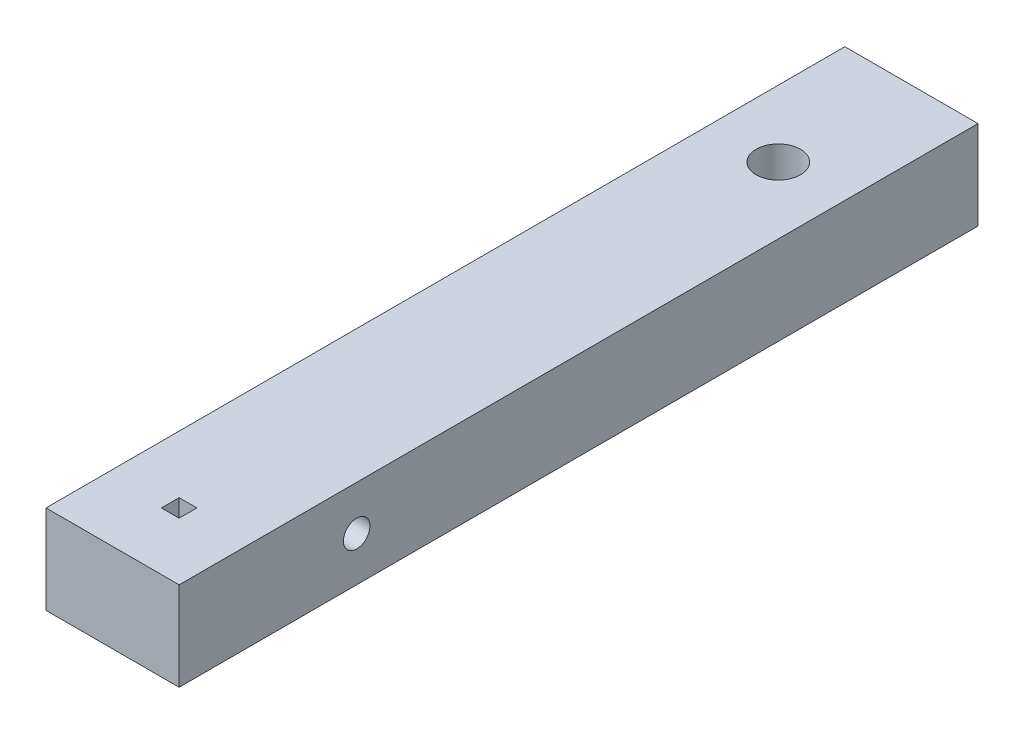
from build123d import *

# Parameters (mm, degrees)
SKETCH1_W           = 15
SKETCH1_H           = 90
BOSS_EXTRUDE1_DEPTH = 10
SKETCH2_R           = 1.5
CUT_EXTRUDE1_DEPTH  = 49.476798574
SKETCH5_W           = 2
SKETCH5_H           = 2
CUT_EXTRUDE4_DEPTH  = 47.703854231
SKETCH6_R           = 2.5
CUT_EXTRUDE5_DEPTH  = 47.703854231
SKETCH7_W           = 2
SKETCH7_H           = 2
CUT_EXTRUDE6_DEPTH  = 15


with BuildPart() as part:
    # Sketch1 → Boss-Extrude1 (new body)
    with BuildSketch(Plane(origin=(0, 0, 0), x_dir=(1, 0, 0), z_dir=(0, 1, 0))):
        Rectangle(SKETCH1_W, SKETCH1_H)
    extrude(amount=BOSS_EXTRUDE1_DEPTH)

    # Sketch2 → Cut-Extrude1 (cut, through all)
    with BuildSketch(Plane(origin=(7.5, 0, 0), x_dir=(0, 0, -1), z_dir=(1, 0, 0))):
        with Locations((-25, 5)):
            Circle(SKETCH2_R)
    extrude(amount=-CUT_EXTRUDE1_DEPTH, mode=Mode.SUBTRACT)

    # Sketch5 → Cut-Extrude4 (cut, through all)
    with BuildSketch(Plane.XZ):
        with Locations((0, 37.5)):
            Rectangle(SKETCH5_W, SKETCH5_H)
    extrude(amount=-CUT_EXTRUDE4_DEPTH, mode=Mode.SUBTRACT)

    # Sketch6 → Cut-Extrude5 (cut, through all)
    with BuildSketch(Plane(origin=(0, 10, 0), x_dir=(-1, 0, 0), z_dir=(0, 1, 0))):
        with Locations((0, -30)):
            Circle(SKETCH6_R)
    extrude(amount=-CUT_EXTRUDE5_DEPTH, mode=Mode.SUBTRACT)

    # Sketch7 → Cut-Extrude6 (cut)
    with BuildSketch(Plane(origin=(0, 0, -45), x_dir=(-1, 0, 0), z_dir=(0, 0, -1))):
        with Locations((0, 5)):
            Rectangle(SKETCH7_W, SKETCH7_H)
    extrude(amount=-CUT_EXTRUDE6_DEPTH, mode=Mode.SUBTRACT)


solid = part.part
